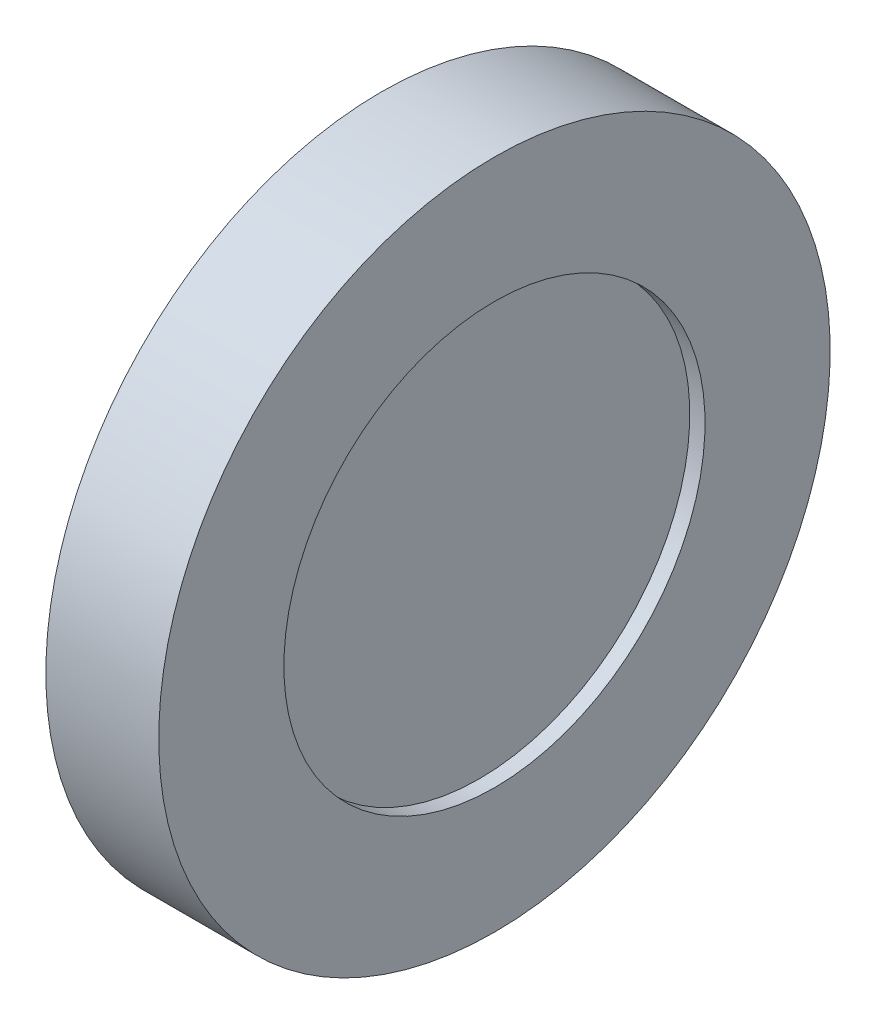
from build123d import *


with BuildPart() as part:
    # Sketch1 → Revolve1 (revolve)
    with BuildSketch(Plane.XY):
        Polygon((-1.85, 11), (-1.85, 6.9), (-1.35, 6.9), (-1.35, 0), (1.35, 0), (1.35, 6.9), (1.85, 6.9), (1.85, 11), align=None)
    revolve(axis=Axis((-1.85, 0, 0), (1, 0, 0)))


solid = part.part
